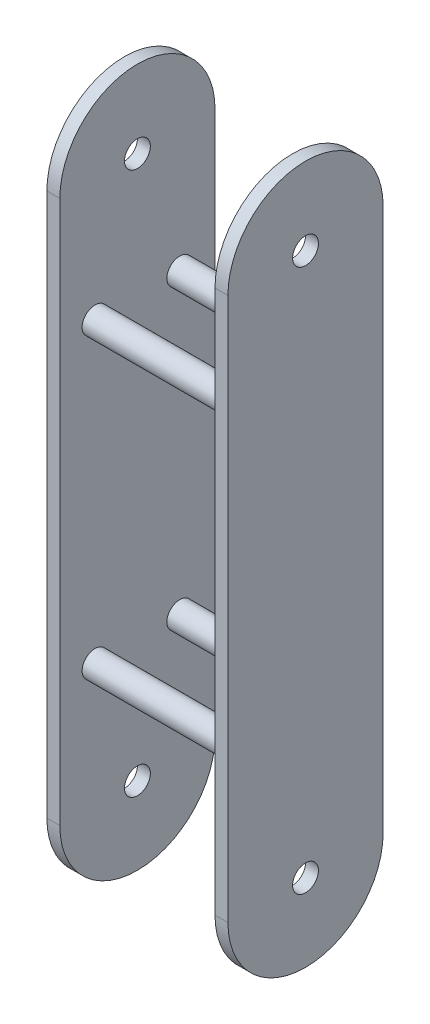
from build123d import *

# Parameters (mm, degrees)
BOSS_EXTRUDE1_DEPTH = 5
BOSS_EXTRUDE2_DEPTH = 5
SKETCH3_R           = 5
CUT_EXTRUDE1_DEPTH  = 156
BOSS_EXTRUDE3_REACH = 157
SKETCH4_R           = 5


with BuildPart() as part:
    # Sketch1 → Boss-Extrude1 (new body)
    with BuildSketch(Plane(origin=(35, 0, 0), x_dir=(0, 0, -1), z_dir=(1, 0, 0))):
        with BuildLine():
            ThreePointArc((30, 105), (0, 135), (-30, 105))
            Line((-30, 105), (-30, -105))
            ThreePointArc((-30, -105), (0, -135), (30, -105))
            Line((30, -105), (30, 105))
        make_face()
    extrude(amount=-BOSS_EXTRUDE1_DEPTH)


with BuildPart() as body_2:
    # Sketch2 → Boss-Extrude2 (new body)
    with BuildSketch(Plane(origin=(-35, 0, 0), x_dir=(0, 0, -1), z_dir=(1, 0, 0))):
        with BuildLine():
            Line((-30, 105), (-30, -105))
            ThreePointArc((-30, -105), (0, -135), (30, -105))
            Line((30, -105), (30, 105))
            ThreePointArc((30, 105), (0, 135), (-30, 105))
        make_face()
    extrude(amount=BOSS_EXTRUDE2_DEPTH)


with BuildPart() as cut_extrude1_tool:
    # Sketch3 → Cut-Extrude1 (new, through all)
    with BuildSketch(Plane(origin=(35, 0, 0), x_dir=(0, 0, -1), z_dir=(1, 0, 0))):
        with Locations((0, 105)):
            Circle(SKETCH3_R)
        with Locations((0, -105)):
            Circle(SKETCH3_R)
    extrude(amount=-CUT_EXTRUDE1_DEPTH)


with BuildPart() as part_1:
    add(part.part)

    # Cut-Extrude1: cut by cut_extrude1_tool
    add(cut_extrude1_tool.part, mode=Mode.SUBTRACT)


with BuildPart() as body_2_1:
    add(body_2.part)

    # Cut-Extrude1: cut by cut_extrude1_tool
    add(cut_extrude1_tool.part, mode=Mode.SUBTRACT)

    # Sketch4 → Boss-Extrude3 (add, up to next)
    with BuildSketch(Plane(origin=(35, 0, 0), x_dir=(0, 0, -1), z_dir=(1, 0, 0)), mode=Mode.PRIVATE) as boss_extrude3_sk1:
        with Locations((-16.384849486, 57.528525166)):
            Circle(SKETCH4_R)
    boss_extrude3_tool1 = extrude(boss_extrude3_sk1.sketch, amount=-BOSS_EXTRUDE3_REACH, mode=Mode.PRIVATE) - body_2_1.part
    # Sketch4 → Boss-Extrude3 (add, up to next)
    with BuildSketch(Plane(origin=(35, 0, 0), x_dir=(0, 0, -1), z_dir=(1, 0, 0)), mode=Mode.PRIVATE) as boss_extrude3_sk2:
        with Locations((16.384849486, 57.528525166)):
            Circle(SKETCH4_R)
    boss_extrude3_tool2 = extrude(boss_extrude3_sk2.sketch, amount=-BOSS_EXTRUDE3_REACH, mode=Mode.PRIVATE) - body_2_1.part
    # Sketch4 → Boss-Extrude3 (add, up to next)
    with BuildSketch(Plane(origin=(35, 0, 0), x_dir=(0, 0, -1), z_dir=(1, 0, 0)), mode=Mode.PRIVATE) as boss_extrude3_sk3:
        with Locations((16.384849486, -57.528525166)):
            Circle(SKETCH4_R)
    boss_extrude3_tool3 = extrude(boss_extrude3_sk3.sketch, amount=-BOSS_EXTRUDE3_REACH, mode=Mode.PRIVATE) - body_2_1.part
    # Sketch4 → Boss-Extrude3 (add, up to next)
    with BuildSketch(Plane(origin=(35, 0, 0), x_dir=(0, 0, -1), z_dir=(1, 0, 0)), mode=Mode.PRIVATE) as boss_extrude3_sk4:
        with Locations((-16.384849486, -57.528525166)):
            Circle(SKETCH4_R)
    boss_extrude3_tool4 = extrude(boss_extrude3_sk4.sketch, amount=-BOSS_EXTRUDE3_REACH, mode=Mode.PRIVATE) - body_2_1.part

    add(part_1.part)  # Boss-Extrude3 merges part
    add(boss_extrude3_tool1.solids().sort_by_distance((35, 57.528525, 16.384849))[0])
    add(boss_extrude3_tool2.solids().sort_by_distance((35, 57.528525, -16.384849))[0])
    add(boss_extrude3_tool3.solids().sort_by_distance((35, -57.528525, -16.384849))[0])
    add(boss_extrude3_tool4.solids().sort_by_distance((35, -57.528525, 16.384849))[0])


solid = body_2_1.part
